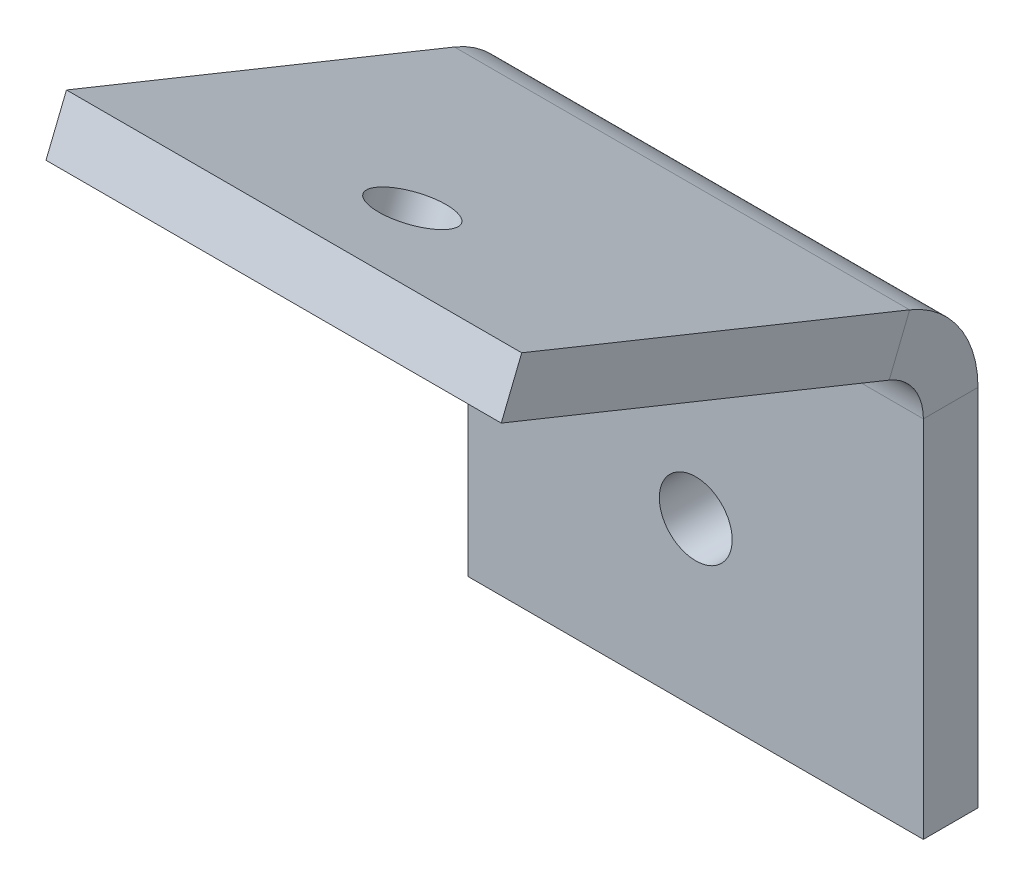
from build123d import *

# Parameters (mm, degrees)
SKETCH1_W               = 25
SKETCH1_H               = 20
SKETCH1_R               = 2
BASE_FLANGE1_DEPTH      = 3
EDGE_FLANGE1_DEPTH      = 25
EDGE_FLANGE1_START      = 3
EDGE_FLANGE1_PROFILE_W  = 25
EDGE_FLANGE1_PROFILE_H  = 22.976474449
EDGE_FLANGE1_PROFILE_R  = 2
EDGE_FLANGE1_FLAT_DEPTH = 3


# Sheet-metal steps are written as plain solids
with BuildPart() as part:
    # Sketch1 → Base-Flange1 (new body)
    with BuildSketch(Plane.XY):
        with Locations((7.971698113, 5.754716981)):
            Rectangle(SKETCH1_W, SKETCH1_H)
        with Locations((7.971698113, 4.754716981)):
            Circle(SKETCH1_R, mode=Mode.SUBTRACT)
    extrude(amount=-BASE_FLANGE1_DEPTH)

    # Edge-Flange1 bend section (across the edge) → Edge-Flange1 (add)
    with BuildSketch(Plane(origin=(20.471698113, 17.778242532, 0), x_dir=(0, -0.9271838545667858, 0.3746065934159162), z_dir=(-1, 0, 0))):
        with BuildLine():
            Line((-3, 2.023525551), (0, 2.023525551))
            ThreePointArc((0, 2.023525551), (0.512887282, 0.34594684), (1.87618022, -0.758026013))
            Line((1.87618022, -0.758026013), (0.75236044, -3.539577577))
            ThreePointArc((0.75236044, -3.539577577), (-1.974225435, -1.33163187), (-3, 2.023525551))
        make_face()
    extrude(amount=EDGE_FLANGE1_DEPTH)

    # Edge-Flange1 profile (on flange) → Edge-Flange1 flat (add)
    with BuildSketch(Plane(origin=(0, 17.778242532, 0), x_dir=(-1, 0, 0), z_dir=(0, 0.9271838545667858, -0.3746065934159162)).offset(EDGE_FLANGE1_START)):
        with Locations((-7.971698113, 13.511762775)):
            Rectangle(EDGE_FLANGE1_PROFILE_W, EDGE_FLANGE1_PROFILE_H)
        with Locations((-7.971698113, 18)):
            Circle(EDGE_FLANGE1_PROFILE_R, mode=Mode.SUBTRACT)
    extrude(amount=-EDGE_FLANGE1_FLAT_DEPTH)


solid = part.part
